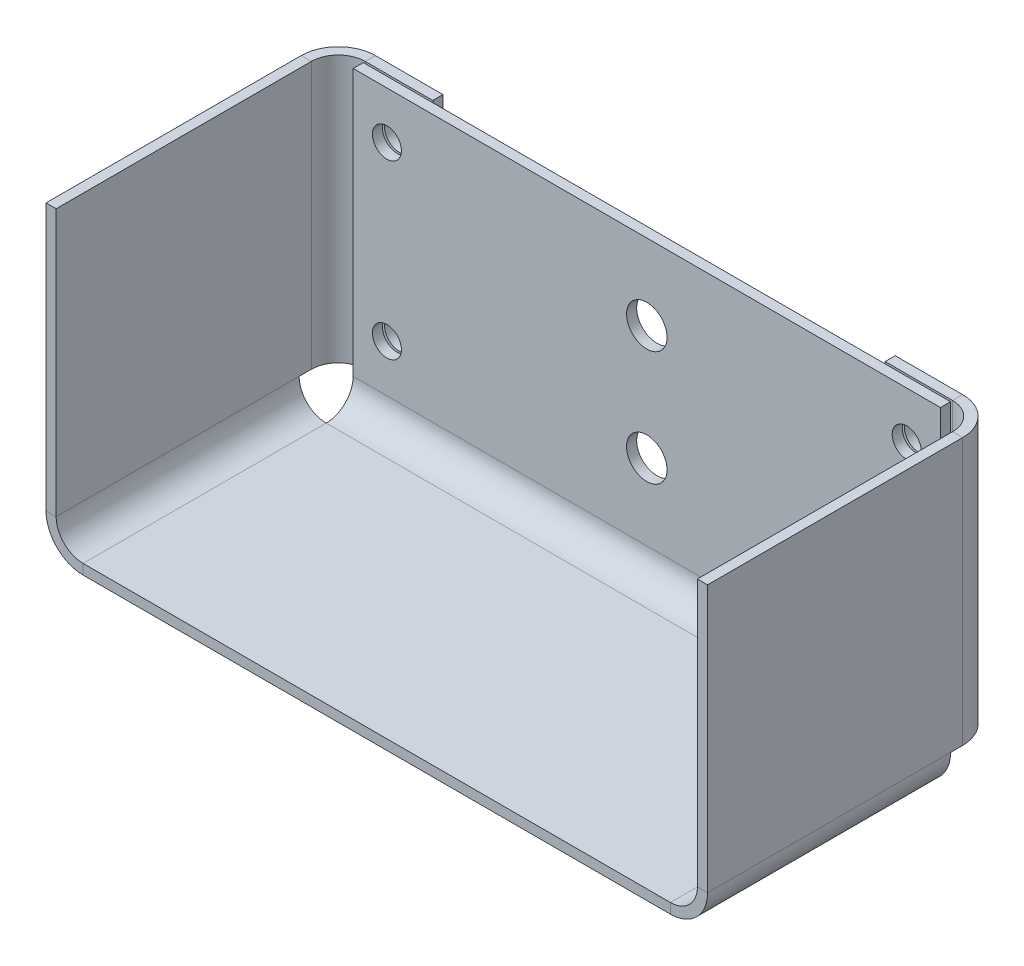
from build123d import *

# Parameters (mm, degrees)
SKETCH1_W                      = 98
SKETCH1_H                      = 45
BOSS_EXTRUDE1_DEPTH            = 10
CONVERT_SOLID1_START           = 1.5
CONVERT_SOLID1_OUTLINE_W       = 98
CONVERT_SOLID1_OUTLINE_H       = 45
CONVERT_SOLID1_DEPTH           = 8.5
EDGE_FLANGE1_STRIP_W           = 14
EDGE_FLANGE1_STRIP_H           = 1.5
EDGE_FLANGE1_STRIP_CUT_DEPTH   = 98
EDGE_FLANGE1_DEPTH             = 98
EDGE_FLANGE2_STRIP_W           = 14
EDGE_FLANGE2_STRIP_H           = 1.5
EDGE_FLANGE2_STRIP_CUT_DEPTH   = 36
EDGE_FLANGE2_STRIP_2_W         = 14
EDGE_FLANGE2_STRIP_2_H         = 1.5
EDGE_FLANGE2_STRIP_CUT_2_DEPTH = 36
EDGE_FLANGE2_DEPTH             = 36
EDGE_FLANGE2_BEND_DEPTH        = 36
SKETCH17_W                     = 5.5
SKETCH17_H                     = 5.5
CUT_EXTRUDE1_DEPTH             = 79.41077732
SKETCH18_W                     = 1.5
SKETCH18_H                     = 39.5
BOSS_EXTRUDE2_DEPTH            = 7.3
EDGE_FLANGE3_STRIP_W           = 14
EDGE_FLANGE3_STRIP_H           = 1.5
EDGE_FLANGE3_STRIP_CUT_DEPTH   = 39.5
EDGE_FLANGE3_STRIP_2_W         = 14
EDGE_FLANGE3_STRIP_2_H         = 1.5
EDGE_FLANGE3_STRIP_CUT_2_DEPTH = 39.5
EDGE_FLANGE3_DEPTH             = 39.5
EDGE_FLANGE3_BEND_DEPTH        = 39.5
SKETCH25_R                     = 2.15
CUT_EXTRUDE2_DEPTH             = 70.153018734
SKETCH26_R                     = 3
CUT_EXTRUDE3_DEPTH             = 10


# Read off the part's stored shape, not the designer's step: Convert-Solid1
# Sheet-metal steps are written as plain solids
with BuildPart() as part:
    # Sketch1 → Boss-Extrude1 (new body)
    with BuildSketch(Plane.XY):
        Rectangle(SKETCH1_W, SKETCH1_H)
    extrude(amount=BOSS_EXTRUDE1_DEPTH)

    # Convert-Solid1 outline → Convert-Solid1 (cut)
    with BuildSketch(Plane.XY.offset(CONVERT_SOLID1_START)):
        Rectangle(CONVERT_SOLID1_OUTLINE_W, CONVERT_SOLID1_OUTLINE_H)
    extrude(amount=CONVERT_SOLID1_DEPTH, mode=Mode.SUBTRACT)

    # Edge-Flange1 strip (across the edge) → Edge-Flange1 strip cut (cut)
    with BuildSketch(Plane(origin=(-49, -22.5, 1.5), x_dir=(0, 1, 0), z_dir=(1, 0, 0))):
        with Locations((-1.5, -0.75)):
            Rectangle(EDGE_FLANGE1_STRIP_W, EDGE_FLANGE1_STRIP_H)
    extrude(amount=EDGE_FLANGE1_STRIP_CUT_DEPTH, mode=Mode.SUBTRACT)

    # Edge-Flange1 section (across the edge) → Edge-Flange1 (add)
    with BuildSketch(Plane(origin=(-49, -22.5, 1.5), x_dir=(0, 1, 0), z_dir=(1, 0, 0))):
        with BuildLine():
            Line((0, 4), (0, 40))
            Line((0, 40), (1.5, 40))
            Line((1.5, 40), (1.5, 4))
            ThreePointArc((1.5, 4), (2.671572875, 1.171572875), (5.5, 0))
            Line((5.5, 0), (5.5, -1.5))
            ThreePointArc((5.5, -1.5), (1.610912703, 0.110912703), (0, 4))
        make_face()
    extrude(amount=EDGE_FLANGE1_DEPTH)

    # Edge-Flange2 strip (across the edge) → Edge-Flange2 strip cut (cut)
    with BuildSketch(Plane(origin=(49, -21, 41.5), x_dir=(-1, 0, 0), z_dir=(0, 0, -1))):
        with Locations((-1.5, -0.75)):
            Rectangle(EDGE_FLANGE2_STRIP_W, EDGE_FLANGE2_STRIP_H)
    extrude(amount=EDGE_FLANGE2_STRIP_CUT_DEPTH, mode=Mode.SUBTRACT)

    # Edge-Flange2 strip 2 (across the edge) → Edge-Flange2 strip cut 2 (cut)
    with BuildSketch(Plane(origin=(-49, -21, 5.5), x_dir=(1, 0, 0), z_dir=(0, 0, 1))):
        with Locations((-1.5, -0.75)):
            Rectangle(EDGE_FLANGE2_STRIP_2_W, EDGE_FLANGE2_STRIP_2_H)
    extrude(amount=EDGE_FLANGE2_STRIP_CUT_2_DEPTH, mode=Mode.SUBTRACT)

    # Edge-Flange2 section (across the edge) → Edge-Flange2 (add)
    with BuildSketch(Plane(origin=(49, -21, 41.5), x_dir=(-1, 0, 0), z_dir=(0, 0, -1))):
        with BuildLine():
            Line((0, 4), (0, 43.5))
            Line((0, 43.5), (1.5, 43.5))
            Line((1.5, 43.5), (1.5, 4))
            ThreePointArc((1.5, 4), (2.671572875, 1.171572875), (5.5, 0))
            Line((5.5, 0), (5.5, -1.5))
            ThreePointArc((5.5, -1.5), (1.610912703, 0.110912703), (0, 4))
        make_face()
    extrude(amount=EDGE_FLANGE2_DEPTH)

    # Edge-Flange2 section 2 (across the edge) → Edge-Flange2 bend (add)
    with BuildSketch(Plane(origin=(-49, -21, 5.5), x_dir=(1, 0, 0), z_dir=(0, 0, 1))):
        with BuildLine():
            Line((0, 4), (0, 43.5))
            Line((0, 43.5), (1.5, 43.5))
            Line((1.5, 43.5), (1.5, 4))
            ThreePointArc((1.5, 4), (2.671572875, 1.171572875), (5.5, 0))
            Line((5.5, 0), (5.5, -1.5))
            ThreePointArc((5.5, -1.5), (1.610912703, 0.110912703), (0, 4))
        make_face()
    extrude(amount=EDGE_FLANGE2_BEND_DEPTH)

    # Sketch17 → Cut-Extrude1 (cut, through all)
    with BuildSketch(Plane(origin=(0, 22.5, 0), x_dir=(1, 0, 0), z_dir=(0, 1, 0))):
        with Locations((-46.25, -2.75)):
            Rectangle(SKETCH17_W, SKETCH17_H)
        with Locations((46.25, -2.75)):
            Rectangle(SKETCH17_W, SKETCH17_H)
    extrude(amount=-CUT_EXTRUDE1_DEPTH, mode=Mode.SUBTRACT)

    # Sketch18 → Boss-Extrude2 (add)
    with BuildSketch(Plane(origin=(0, 0, 5.5), x_dir=(-1, 0, 0), z_dir=(0, 0, -1))):
        with Locations((-48.25, 2.75)):
            Rectangle(SKETCH18_W, SKETCH18_H)
        with Locations((48.25, 2.75)):
            Rectangle(SKETCH18_W, SKETCH18_H)
    extrude(amount=BOSS_EXTRUDE2_DEPTH)

    # Edge-Flange3 strip (across the edge) → Edge-Flange3 strip cut (cut)
    with BuildSketch(Plane(origin=(47.5, 22.5, -1.8), x_dir=(0, 0, 1), z_dir=(0, -1, 0))):
        with Locations((-1.5, -0.75)):
            Rectangle(EDGE_FLANGE3_STRIP_W, EDGE_FLANGE3_STRIP_H)
    extrude(amount=EDGE_FLANGE3_STRIP_CUT_DEPTH, mode=Mode.SUBTRACT)

    # Edge-Flange3 strip 2 (across the edge) → Edge-Flange3 strip cut 2 (cut)
    with BuildSketch(Plane(origin=(-47.5, -17, -1.8), x_dir=(0, 0, 1), z_dir=(0, 1, 0))):
        with Locations((-1.5, -0.75)):
            Rectangle(EDGE_FLANGE3_STRIP_2_W, EDGE_FLANGE3_STRIP_2_H)
    extrude(amount=EDGE_FLANGE3_STRIP_CUT_2_DEPTH, mode=Mode.SUBTRACT)

    # Edge-Flange3 section (across the edge) → Edge-Flange3 (add)
    with BuildSketch(Plane(origin=(47.5, 22.5, -1.8), x_dir=(0, 0, 1), z_dir=(0, -1, 0))):
        with BuildLine():
            Line((0, 4), (0, 14))
            Line((0, 14), (1.5, 14))
            Line((1.5, 14), (1.5, 4))
            ThreePointArc((1.5, 4), (2.671572875, 1.171572875), (5.5, 0))
            Line((5.5, 0), (5.5, -1.5))
            ThreePointArc((5.5, -1.5), (1.610912703, 0.110912703), (0, 4))
        make_face()
    extrude(amount=EDGE_FLANGE3_DEPTH)

    # Edge-Flange3 section 2 (across the edge) → Edge-Flange3 bend (add)
    with BuildSketch(Plane(origin=(-47.5, -17, -1.8), x_dir=(0, 0, 1), z_dir=(0, 1, 0))):
        with BuildLine():
            Line((0, 4), (0, 14))
            Line((0, 14), (1.5, 14))
            Line((1.5, 14), (1.5, 4))
            ThreePointArc((1.5, 4), (2.671572875, 1.171572875), (5.5, 0))
            Line((5.5, 0), (5.5, -1.5))
            ThreePointArc((5.5, -1.5), (1.610912703, 0.110912703), (0, 4))
        make_face()
    extrude(amount=EDGE_FLANGE3_BEND_DEPTH)

    # Sketch25 → Cut-Extrude2 (cut, through all)
    with BuildSketch(Plane(origin=(0, 0, -1.8), x_dir=(-1, 0, 0), z_dir=(0, 0, -1))):
        with Locations((38.5, 15.5)):
            Circle(SKETCH25_R)
        with Locations((38.5, -10)):
            Circle(SKETCH25_R)
        with Locations(Location((-38.5, -10, 0), (0, 0, 180))):
            Circle(SKETCH25_R)
        with Locations(Location((-38.5, 15.5, 0), (0, 0, 180))):
            Circle(SKETCH25_R)
    extrude(amount=-CUT_EXTRUDE2_DEPTH, mode=Mode.SUBTRACT)

    # Sketch26 → Cut-Extrude3 (cut)
    with BuildSketch(Plane.XY.offset(1.5)):
        with Locations((0, 11.25)):
            Circle(SKETCH26_R)
        with Locations((0, -5.75)):
            Circle(SKETCH26_R)
    extrude(amount=-CUT_EXTRUDE3_DEPTH, mode=Mode.SUBTRACT)


solid = part.part
